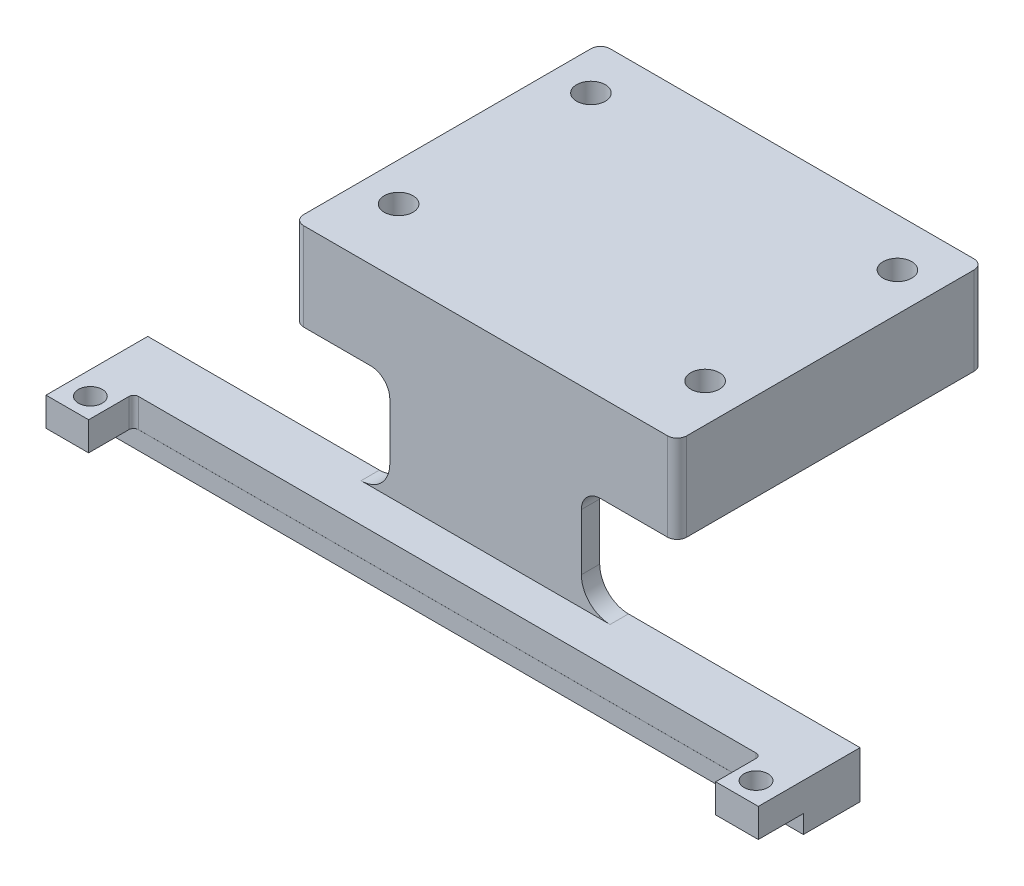
from build123d import *

# Parameters (mm, degrees)
IZIM2_W                          = 40
IZIM2_H                          = 32
Y_KSEKLIK_EKSTR_ZYON1_DEPTH      = 9.17
IZIM3_W                          = 40
IZIM3_H                          = 1.915150366
Y_KSEKLIK_EKSTR_ZYON2_DEPTH      = 12.39
IZIM4_W                          = 10
IZIM4_H                          = 12.39
KES_EKSTR_ZYON1_DEPTH            = 12.39
Y_KSEKLIK_EKSTR_ZYON3_DEPTH      = 4
Y_KSEKLIK_EKSTR_ZYON3_DEPTH_BACK = 1.91515
IZIM5_W                          = 74.37
IZIM5_H                          = 3
IZIM6_W                          = 4.45
IZIM6_H                          = 3
Y_KSEKLIK_EKSTR_ZYON4_DEPTH      = 4.71
IZIM7_W                          = 5.92
IZIM7_H                          = 1.9
Y_KSEKLIK_EKSTR_ZYON5_DEPTH      = 74.37
RADYUS1_R                        = 3
RADYUS2_R                        = 2
RADYUS3_R                        = 1
RADYUS4_R                        = 0.5
IZIM8_R                          = 1.25
KES_EKSTR_ZYON2_DEPTH            = 10
IZIM9_R                          = 1.5
KES_EKSTR_ZYON3_DEPTH            = 10


with BuildPart() as part:
    # Çizim2 → Yükseklik-Ekstrüzyon1 (new body)
    with BuildSketch(Plane(origin=(0, 0, 0), x_dir=(1, 0, 0), z_dir=(0, 1, 0))):
        Rectangle(IZIM2_W, IZIM2_H)
    extrude(amount=Y_KSEKLIK_EKSTR_ZYON1_DEPTH)

    # Çizim3 → Yükseklik-Ekstrüzyon2 (add)
    with BuildSketch(Plane(origin=(0, 0, 0), x_dir=(-1, 0, 0), z_dir=(0, -1, 0))):
        with Locations((0, -15.042424817)):
            Rectangle(IZIM3_W, IZIM3_H)
    extrude(amount=Y_KSEKLIK_EKSTR_ZYON2_DEPTH)

    # Çizim4 → Kes-Ekstrüzyon1 (cut)
    with BuildSketch(Plane.XY.offset(16)):
        with Locations((-15, -6.195)):
            Rectangle(IZIM4_W, IZIM4_H)
        with Locations((15, -6.195)):
            Rectangle(IZIM4_W, IZIM4_H)
    extrude(amount=-KES_EKSTR_ZYON1_DEPTH, mode=Mode.SUBTRACT)

    # Çizim5 → Yükseklik-Ekstrüzyon3 (add, two sides: drawn at the far end of the back side and taken through both)
    with BuildSketch(Plane.XY.offset(16).offset(-Y_KSEKLIK_EKSTR_ZYON3_DEPTH_BACK)):
        with Locations((0, -12.39)):
            Rectangle(IZIM5_W, IZIM5_H)
    extrude(amount=Y_KSEKLIK_EKSTR_ZYON3_DEPTH + Y_KSEKLIK_EKSTR_ZYON3_DEPTH_BACK)

    # Çizim6 → Yükseklik-Ekstrüzyon4 (add)
    with BuildSketch(Plane.XY.offset(20)):
        with Locations((-34.96, -12.39)):
            Rectangle(IZIM6_W, IZIM6_H)
        with Locations((34.96, -12.39)):
            Rectangle(IZIM6_W, IZIM6_H)
    extrude(amount=Y_KSEKLIK_EKSTR_ZYON4_DEPTH)

    # Çizim7 → Yükseklik-Ekstrüzyon5 (add)
    with BuildSketch(Plane(origin=(37.185, 0, 0), x_dir=(0, 0, -1), z_dir=(1, 0, 0))):
        with Locations((-17.044849634, -14.84)):
            Rectangle(IZIM7_W, IZIM7_H)
    extrude(amount=-Y_KSEKLIK_EKSTR_ZYON5_DEPTH)

    # Radyus1
    radyus1_edges = [part.edges().sort_by_distance(p)[0] for p in [
        (-10, -10.89, 15.042425),
        (10, -10.89, 15.042425),
    ]]
    fillet(radyus1_edges, radius=RADYUS1_R)

    # Radyus2
    radyus2_edges = [part.edges().sort_by_distance(p)[0] for p in [
        (-10, 0, 15.042424817),
        (10, 0, 15.042424817),
    ]]
    fillet(radyus2_edges, radius=RADYUS2_R)

    # Radyus3
    radyus3_edges = [part.edges().sort_by_distance(p)[0] for p in [
        (-20, 4.585, -16),
        (20, 4.585, -16),
        (20, 4.585, 16),
        (-20, 4.585, 16),
    ]]
    fillet(radyus3_edges, radius=RADYUS3_R)

    # Radyus4
    # the kernel refuses this fillet: 0.5 mm, written as the material it adds along each edge
    with BuildSketch(Plane(origin=(-32.735, -10.89, 20), x_dir=(1, 0, 0), z_dir=(0, -1, 0)), Plane(origin=(32.735, -10.89, 20), x_dir=(0, 0, 1), z_dir=(0, -1, 0))) as radyus4_piece_1:
        with BuildLine():
            CenterArc((RADYUS4_R, RADYUS4_R), RADYUS4_R, 180, 90)
            Line((0, RADYUS4_R), (0, 0))
            Line((0, 0), (RADYUS4_R, 0))
        make_face()
    extrude(amount=3)

    # Çizim8 → Kes-Ekstrüzyon2 (cut)
    with BuildSketch(Plane(origin=(0, -10.89, 0), x_dir=(1, 0, 0), z_dir=(0, 1, 0))):
        with Locations(Location((-34.765, -22.5, 0), (0, 0, 180))):
            Circle(IZIM8_R)
        with Locations(Location((34.735, -22.5, 0), (0, 0, 180))):
            Circle(IZIM8_R)
    extrude(amount=-KES_EKSTR_ZYON2_DEPTH, mode=Mode.SUBTRACT)

    # Çizim9 → Kes-Ekstrüzyon3 (cut)
    with BuildSketch(Plane(origin=(0, 9.17, 0), x_dir=(1, 0, 0), z_dir=(0, 1, 0))):
        with Locations(Location((-16, -9.08, 0), (0, 0, 270))):
            Circle(IZIM9_R)
        with Locations(Location((-16, 11, 0), (0, 0, 270))):
            Circle(IZIM9_R)
        with Locations(Location((16, 11, 0), (0, 0, 270))):
            Circle(IZIM9_R)
        with Locations(Location((16, -9.08, 0), (0, 0, 270))):
            Circle(IZIM9_R)
    extrude(amount=-KES_EKSTR_ZYON3_DEPTH, mode=Mode.SUBTRACT)


solid = part.part
